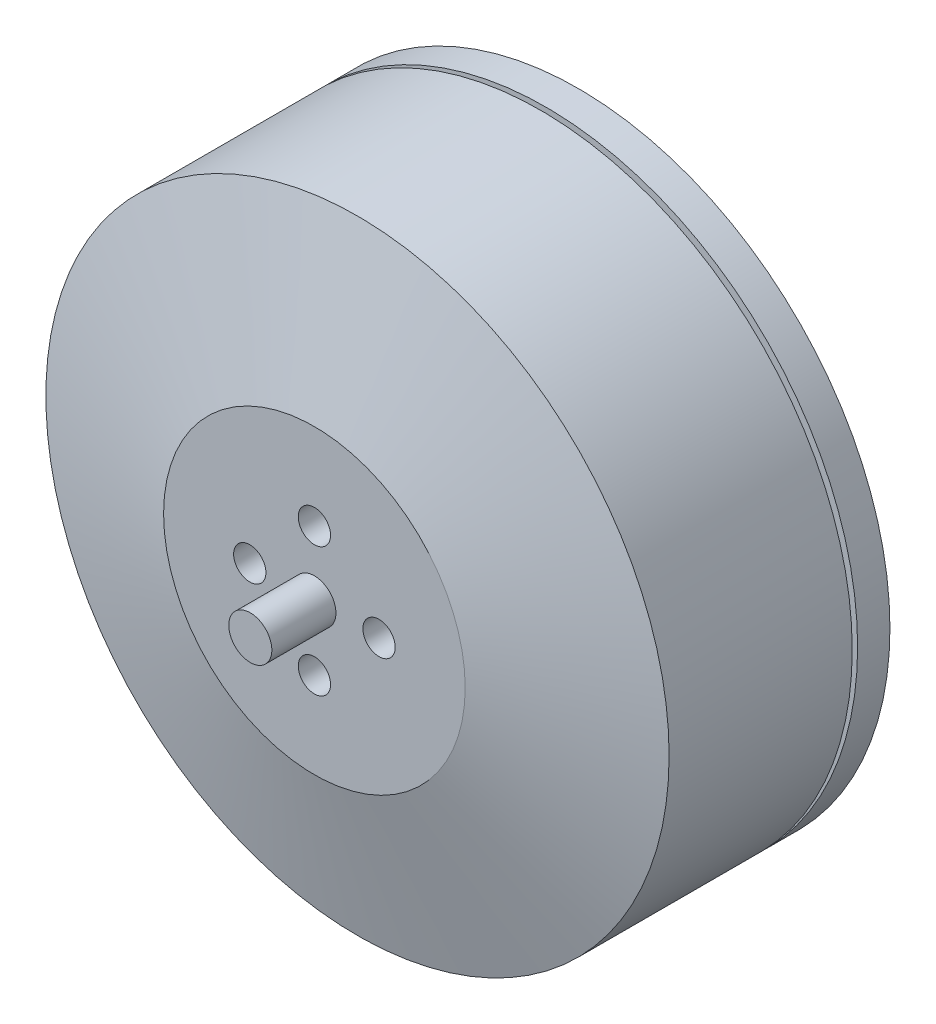
from build123d import *

# Parameters (mm, degrees)
SKETCH4_R           = 2
BOSS_EXTRUDE1_DEPTH = 5.95
SKETCH5_R           = 1.5
CUT_EXTRUDE1_DEPTH  = 5
SKETCH6_R           = 1.5
CUT_EXTRUDE2_DEPTH  = 5
SKETCH7_R           = 4.25
BOSS_EXTRUDE2_DEPTH = 4.3
SKETCH8_R           = 2.8
CUT_EXTRUDE3_DEPTH  = 0.1
CUT_EXTRUDE4_DEPTH  = 1.5
SKETCH10_R          = 6.5
SKETCH10_R_2        = 5.5
CUT_EXTRUDE5_DEPTH  = 0.1


with BuildPart() as part:
    # Sketch3 → Revolve1 (revolve)
    with BuildSketch(Plane(origin=(0, 0, 0), x_dir=(0, 0, -1), z_dir=(1, 0, 0))):
        Polygon((-29.5, 0), (-29.5, 14), (-25.5, 28.93), (-8.5, 28.93), (-8.5, 26.93), (-8, 26.93), (-8, 28.93), (-5, 28.93), (0, 17.75), (0, 9), (-1.5, 7.5), (-1.5, 0), align=None)
    revolve(axis=Axis((0, 0, 66.283384922), (0, 0, -1)))

    # Sketch4 → Boss-Extrude1 (add)
    with BuildSketch(Plane.XY.offset(29.5)):
        Circle(SKETCH4_R)
    extrude(amount=BOSS_EXTRUDE1_DEPTH)

    # Sketch5 → Cut-Extrude1 (cut)
    with BuildSketch(Plane.XY.offset(29.5)):
        with Locations((0, 6)):
            Circle(SKETCH5_R)
        with Locations((6, 0)):
            Circle(SKETCH5_R)
        with Locations((0, -6)):
            Circle(SKETCH5_R)
        with Locations((-6, 0)):
            Circle(SKETCH5_R)
    extrude(amount=-CUT_EXTRUDE1_DEPTH, mode=Mode.SUBTRACT)

    # Sketch6 → Cut-Extrude2 (cut)
    with BuildSketch(Plane(origin=(0, 0, 0), x_dir=(-1, 0, 0), z_dir=(0, 0, -1))):
        with Locations((0, 12.5)):
            Circle(SKETCH6_R)
        with Locations((12.5, 0)):
            Circle(SKETCH6_R)
        with Locations((0, -12.5)):
            Circle(SKETCH6_R)
        with Locations((-12.5, 0)):
            Circle(SKETCH6_R)
    extrude(amount=-CUT_EXTRUDE2_DEPTH, mode=Mode.SUBTRACT)

    # Sketch7 → Boss-Extrude2 (add)
    with BuildSketch(Plane(origin=(0, 0, 1.5), x_dir=(-1, 0, 0), z_dir=(0, 0, -1))):
        Circle(SKETCH7_R)
    extrude(amount=BOSS_EXTRUDE2_DEPTH)

    # Sketch8 → Cut-Extrude3 (cut)
    with BuildSketch(Plane(origin=(0, 0, -2.8), x_dir=(-1, 0, 0), z_dir=(0, 0, -1))):
        Circle(SKETCH8_R)
    extrude(amount=-CUT_EXTRUDE3_DEPTH, mode=Mode.SUBTRACT)

    # Sketch9 → Cut-Extrude4 (cut)
    with BuildSketch(Plane(origin=(0, 0, -2.7), x_dir=(-1, 0, 0), z_dir=(0, 0, -1))):
        Polygon((0, -1.154700538), (1, -0.577350269), (1, 0.577350269), (0, 1.154700538), (-1, 0.577350269), (-1, -0.577350269), align=None)
    extrude(amount=-CUT_EXTRUDE4_DEPTH, mode=Mode.SUBTRACT)

    # Sketch10 → Cut-Extrude5 (cut)
    with BuildSketch(Plane(origin=(0, 0, 1.5), x_dir=(-1, 0, 0), z_dir=(0, 0, -1))):
        Circle(SKETCH10_R)
        Circle(SKETCH10_R_2, mode=Mode.SUBTRACT)
    extrude(amount=-CUT_EXTRUDE5_DEPTH, mode=Mode.SUBTRACT)


solid = part.part
